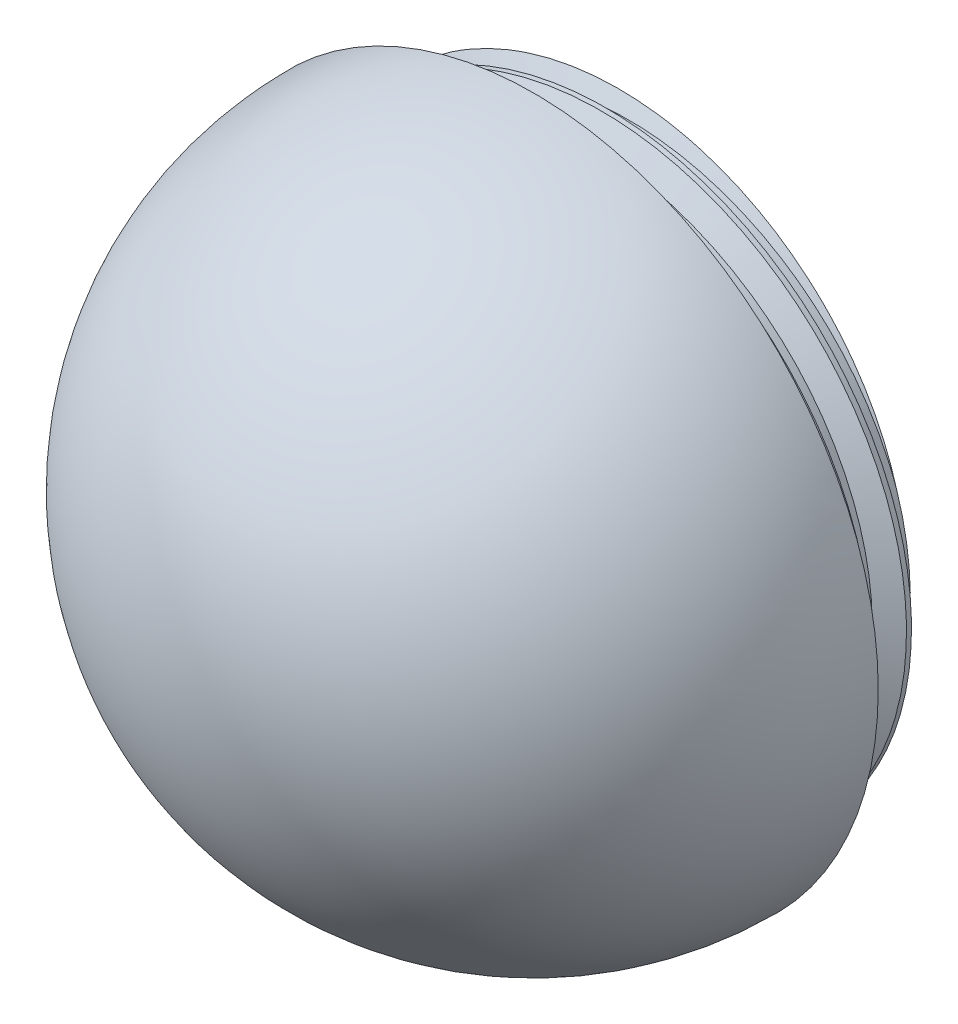
from build123d import *
from build123d.topology import SkipClean

# Parameters (mm, degrees)
REVOLVE1_ANGLE           = 180
SHELL1_T                 = -1
BOSS_EXTRUDE1_REACH      = 39.239
BOSS_EXTRUDE1_END_RADIUS = 20.5
SKETCH2_R                = 20.5
SKETCH2_R_2              = 15.5
BOSS_EXTRUDE2_START      = 6
SKETCH4_R                = 17.5
SKETCH4_R_2              = 15.5
BOSS_EXTRUDE2_DEPTH      = 6
THREAD1_PITCH            = 2.5
THREAD1_FROM             = 2


with BuildPart() as part:
    # Sketch1 → Revolve1 (revolve)
    with BuildSketch(Plane.XY):
        with BuildLine():
            Line((0, 21.5), (0, -21.5))
            ThreePointArc((0, -21.5), (21.5, 0), (0, 21.5))
        make_face()
    revolve(axis=Axis((0, 21.5, 0), (0, -1, 0)), revolution_arc=REVOLVE1_ANGLE)

    # Shell1
    shell1_openings = [part.faces().sort_by_distance(p)[0] for p in [
        (0, 0, 0),
    ]]
    offset(amount=SHELL1_T, openings=shell1_openings)

    # Boss-Extrude1: up to this sphere (the profile starts inside it)
    with SkipClean():  # the faces are left unmerged after this step: merging them gives an invalid solid
        boss_extrude1_end = Location((0, 0, 0)) * Sphere(BOSS_EXTRUDE1_END_RADIUS, mode=Mode.PRIVATE)
        # Sketch2 → Boss-Extrude1 (add, up to the surface)
        with BuildSketch(Plane(origin=(0, 0, 0), x_dir=(-1, 0, 0), z_dir=(0, 0, -1)), mode=Mode.PRIVATE) as boss_extrude1_sk1:
            Circle(SKETCH2_R)
            Circle(SKETCH2_R_2, mode=Mode.SUBTRACT)
        boss_extrude1_tool1 = extrude(boss_extrude1_sk1.sketch, amount=-BOSS_EXTRUDE1_REACH, mode=Mode.PRIVATE) & boss_extrude1_end
        add(boss_extrude1_tool1.solids().sort_by_distance((19.920172, 0, 0))[0])

    # Sketch4 → Boss-Extrude2 (add)
    with SkipClean():  # the faces are left unmerged after this step: merging them gives an invalid solid
        with BuildSketch(Plane(origin=(0, 0, 0), x_dir=(-1, 0, 0), z_dir=(0, 0, -1)).offset(BOSS_EXTRUDE2_START)):
            with Locations(Location((0, 0, 0), (0, 0, 180))):
                Circle(SKETCH4_R)
            Circle(SKETCH4_R_2, mode=Mode.SUBTRACT)
        extrude(amount=-BOSS_EXTRUDE2_DEPTH)

    # Thread1: arcs per turn and ends read off the stored shape
    # Thread1: the profile of Thread Profile1 profile screwed along a right-hand helix through 3.2 turns, 10 arcs to a turn; built about Z, then put on its axis
    with SkipClean():  # the faces are left unmerged after this step: merging them gives an invalid solid
        thread1_z = Axis((0, 0, 0), (0, 0, 1))
        thread1_corners = [(17.4997, 0, -0.000173205), (18.853164688, 0, 0.781249997), (18.853164688, 0, 1.093749997), (17.4997, 0, 1.875173198)]
        with BuildLine(mode=Mode.PRIVATE) as thread1_profile:
            Line(thread1_corners[0], thread1_corners[1])
            Line(thread1_corners[1], thread1_corners[2])
            Line(thread1_corners[2], thread1_corners[3])
            Line(thread1_corners[3], thread1_corners[0])
        thread1_cap = Face(thread1_profile.wire())
        thread1_turn_angles = [0, 18, 36, 54, 72, 90, 108, 126, 144, 162, 180, 198, 216, 234, 252, 270, 288, 306, 324, 342, 360]
        thread1_turn_weights = [1, 0.9510565162951535, 1, 0.9510565162951535, 1, 0.9510565162951535, 1, 0.9510565162951535, 1, 0.9510565162951535, 1, 0.9510565162951535, 1, 0.9510565162951535, 1, 0.9510565162951535, 1, 0.9510565162951535, 1, 0.9510565162951535, 1]
        thread1_turn_rails = [Edge.make_bspline([Vector(p[0], p[1], 0).rotate(thread1_z, thread1_turn_angles[k]) / thread1_turn_weights[k] + Vector(0, 0, p[2] + THREAD1_PITCH * thread1_turn_angles[k] / 360) for k in range(21)], [0, 0, 0, 1, 1, 2, 2, 3, 3, 4, 4, 5, 5, 6, 6, 7, 7, 8, 8, 9, 9, 10, 10, 10], 2, thread1_turn_weights) for p in thread1_corners]
        thread1_turn_sides = [Face.make_surface_from_curves(thread1_turn_rails[p[0]], thread1_turn_rails[p[1]]) for p in [(0, 1), (1, 2), (2, 3), (3, 0)]]
        thread1_last_angles = [1080, 1098, 1116, 1134, 1152]
        thread1_last_weights = [1, 0.9510565162951535, 1, 0.9510565162951542, 1]
        thread1_last_rails = [Edge.make_bspline([Vector(p[0], p[1], 0).rotate(thread1_z, thread1_last_angles[k]) / thread1_last_weights[k] + Vector(0, 0, p[2] + THREAD1_PITCH * thread1_last_angles[k] / 360) for k in range(5)], [0, 0, 0, 1, 1, 2, 2, 2], 2, thread1_last_weights) for p in thread1_corners]
        thread1_last_sides = [Face.make_surface_from_curves(thread1_last_rails[p[0]], thread1_last_rails[p[1]]) for p in [(0, 1), (1, 2), (2, 3), (3, 0)]]
        thread1 = Plane(origin=(0, 0, -8), x_dir=(1, 0, 0), z_dir=(0, 0, 1)) * split(Solid(Shell([*[p.moved(Location((0, 0, THREAD1_PITCH * i))) for i in range(3) for p in thread1_turn_sides], *thread1_last_sides, thread1_cap, thread1_cap.rotate(thread1_z, 1152).moved(Location((0, 0, THREAD1_PITCH * 1152 / 360)))])), bisect_by=Plane.XY.offset(THREAD1_FROM), keep=Keep.TOP, mode=Mode.PRIVATE)
        add(thread1)


solid = part.part
